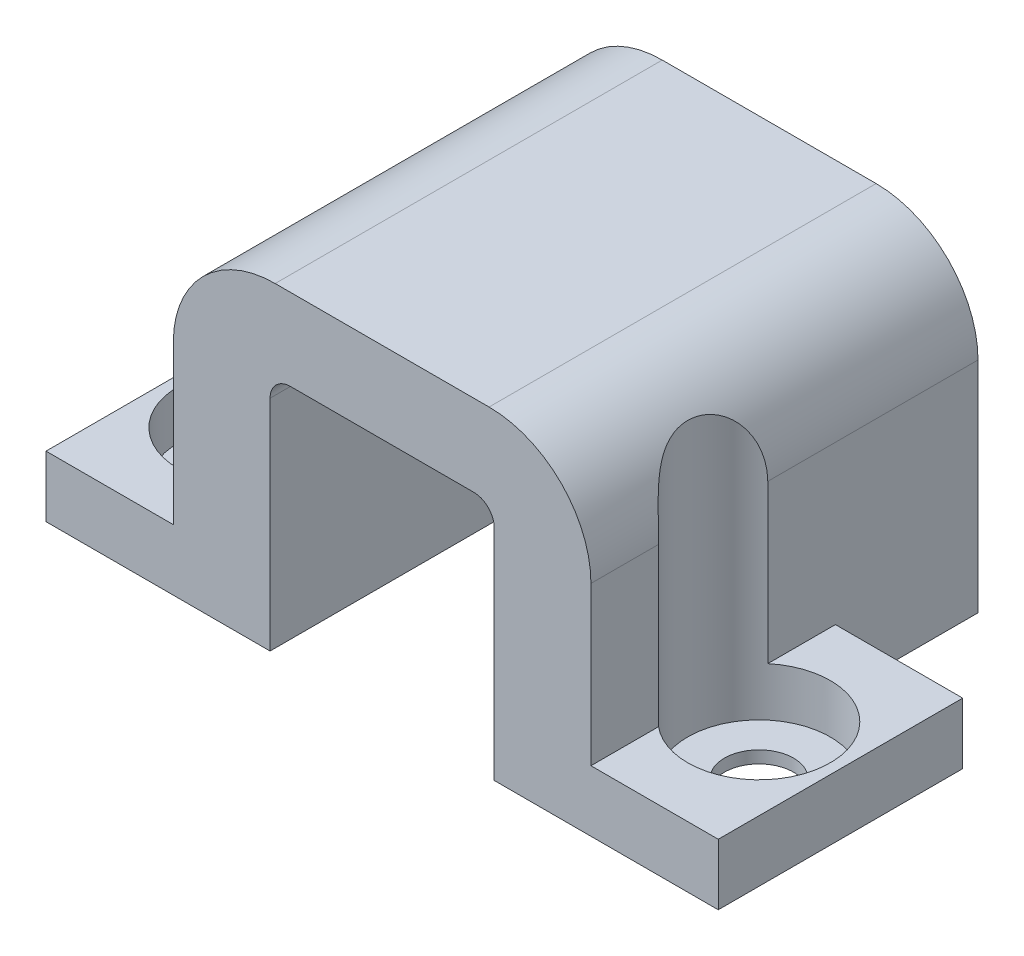
from build123d import *

# Parameters (mm, degrees)
BOSS_EXTRUDE2_DEPTH                      = 3
BOSS_EXTRUDE2_2_DEPTH                    = 3
SKETCH2_W                                = 4
SKETCH2_H                                = 19
BOSS_EXTRUDE3_DEPTH                      = 12.75
SKETCH3_W                                = 19
SKETCH3_H                                = 15.75
BOSS_EXTRUDE4_DEPTH                      = 0.75
SKETCH4_W                                = 19
SKETCH4_H                                = 15.75
BOSS_EXTRUDE5_DEPTH                      = 0.75
SKETCH5_W                                = 19
SKETCH5_H                                = 4
BOSS_EXTRUDE6_DEPTH                      = 11
FILLET1_R                                = 5
FILLET2_R                                = 1
CBORE_START                              = 5.6
CBORE_FOR_M3_PAN_HEAD_SCREW1_OUTLINE_R   = 3.5
CBORE_FOR_M3_PAN_HEAD_SCREW1_DEPTH       = 2.4
CBORE_START_2                            = 5
CBORE_FOR_M3_PAN_HEAD_SCREW1_2_OUTLINE_R = 1.7
CBORE_FOR_M3_PAN_HEAD_SCREW1_2_DEPTH     = 0.6
CUT_EXTRUDE1_START                       = -15.15
SKETCH8_R                                = 3.5
CUT_EXTRUDE1_DEPTH                       = 15.15
CUT_EXTRUDE2_START                       = -15.15
SKETCH9_R                                = 3.5
CUT_EXTRUDE2_DEPTH                       = 15.15


# Read off the part's stored shape, not the designer's step: CBORE for M3 Pan Head Screw1
with BuildPart() as part:
    # Sketch1 → Boss-Extrude2 (new body)
    with BuildSketch(Plane(origin=(0, 5, 0), x_dir=(1, 0, 0), z_dir=(0, 1, 0))):
        Polygon((6.998679183, -26), (0.748679183, -26), (0.748679183, -38), (10.998679183, -38), (10.998679183, -19), (6.998679183, -19), align=None)
    extrude(amount=BOSS_EXTRUDE2_DEPTH)



with BuildPart() as body_2:
    # Sketch1 → Boss-Extrude2 2 (new body)
    with BuildSketch(Plane(origin=(0, 5, 0), x_dir=(1, 0, 0), z_dir=(0, 1, 0))):
        Polygon((27.498679183, -26), (33.748679183, -26), (33.748679183, -38), (23.498679183, -38), (23.498679183, -19), (27.498679183, -19), align=None)
    extrude(amount=BOSS_EXTRUDE2_2_DEPTH)


with BuildPart() as part_1:
    add(part.part)

    add(body_2.part)  # Boss-Extrude3 merges body 2
    # Sketch2 → Boss-Extrude3 (add)
    with BuildSketch(Plane(origin=(0, 8, 0), x_dir=(1, 0, 0), z_dir=(0, 1, 0))):
        with Locations((8.998679183, -28.5)):
            Rectangle(SKETCH2_W, SKETCH2_H)
        with Locations((25.498679183, -28.5)):
            Rectangle(SKETCH2_W, SKETCH2_H)
    extrude(amount=BOSS_EXTRUDE3_DEPTH)

    # Sketch3 → Boss-Extrude4 (add)
    with BuildSketch(Plane(origin=(10.998679183, 0, 0), x_dir=(0, 0, -1), z_dir=(1, 0, 0))):
        with Locations((-28.5, 12.875)):
            Rectangle(SKETCH3_W, SKETCH3_H)
    extrude(amount=BOSS_EXTRUDE4_DEPTH)

    # Sketch4 → Boss-Extrude5 (add)
    with BuildSketch(Plane.ZY.offset(-23.498679183)):
        with Locations((28.5, 12.875)):
            Rectangle(SKETCH4_W, SKETCH4_H)
    extrude(amount=BOSS_EXTRUDE5_DEPTH)

    # Sketch5 → Boss-Extrude6 (add)
    with BuildSketch(Plane(origin=(11.748679183, 0, 0), x_dir=(0, 0, -1), z_dir=(1, 0, 0))):
        with Locations((-28.5, 18.75)):
            Rectangle(SKETCH5_W, SKETCH5_H)
    extrude(amount=BOSS_EXTRUDE6_DEPTH)

    # Fillet1
    fillet1_edges = [part_1.edges().sort_by_distance(p)[0] for p in [
        (6.998679183, 20.75, 28.5),
        (27.498679183, 20.75, 28.5),
    ]]
    fillet(fillet1_edges, radius=FILLET1_R)

    # Fillet2
    fillet2_edges = [part_1.edges().sort_by_distance(p)[0] for p in [
        (22.748679183, 16.75, 28.5),
        (11.748679183, 16.75, 28.5),
    ]]
    fillet(fillet2_edges, radius=FILLET2_R)

    # CBORE for M3 Pan Head Screw1 outline → CBORE for M3 Pan Head Screw1 (cut)
    with BuildSketch(Plane(origin=(0, 0, 0), x_dir=(1, 0, 0), z_dir=(0, 1, 0)).offset(CBORE_START)):
        with Locations((29.748679183, -32)):
            Circle(CBORE_FOR_M3_PAN_HEAD_SCREW1_OUTLINE_R)
        with Locations((4.748679183, -32)):
            Circle(CBORE_FOR_M3_PAN_HEAD_SCREW1_OUTLINE_R)
    extrude(amount=CBORE_FOR_M3_PAN_HEAD_SCREW1_DEPTH, mode=Mode.SUBTRACT)

    # CBORE for M3 Pan Head Screw1 2 outline → CBORE for M3 Pan Head Screw1 2 (cut)
    with BuildSketch(Plane(origin=(0, 0, 0), x_dir=(1, 0, 0), z_dir=(0, 1, 0)).offset(CBORE_START_2)):
        with Locations((29.748679183, -32)):
            Circle(CBORE_FOR_M3_PAN_HEAD_SCREW1_2_OUTLINE_R)
        with Locations((4.748679183, -32)):
            Circle(CBORE_FOR_M3_PAN_HEAD_SCREW1_2_OUTLINE_R)
    extrude(amount=CBORE_FOR_M3_PAN_HEAD_SCREW1_2_DEPTH, mode=Mode.SUBTRACT)

    # Sketch8 → Cut-Extrude1 (cut)
    with BuildSketch(Plane(origin=(0, 20.75, 0), x_dir=(1, 0, 0), z_dir=(0, 1, 0)).offset(CUT_EXTRUDE1_START)):
        with Locations(Location((4.748679183, -32, 0), (0, 0, 270))):
            Circle(SKETCH8_R)
    extrude(amount=CUT_EXTRUDE1_DEPTH, mode=Mode.SUBTRACT)

    # Sketch9 → Cut-Extrude2 (cut)
    with BuildSketch(Plane(origin=(0, 20.75, 0), x_dir=(1, 0, 0), z_dir=(0, 1, 0)).offset(CUT_EXTRUDE2_START)):
        with Locations(Location((29.748679183, -32, 0), (0, 0, 270))):
            Circle(SKETCH9_R)
    extrude(amount=CUT_EXTRUDE2_DEPTH, mode=Mode.SUBTRACT)


solid = part_1.part
